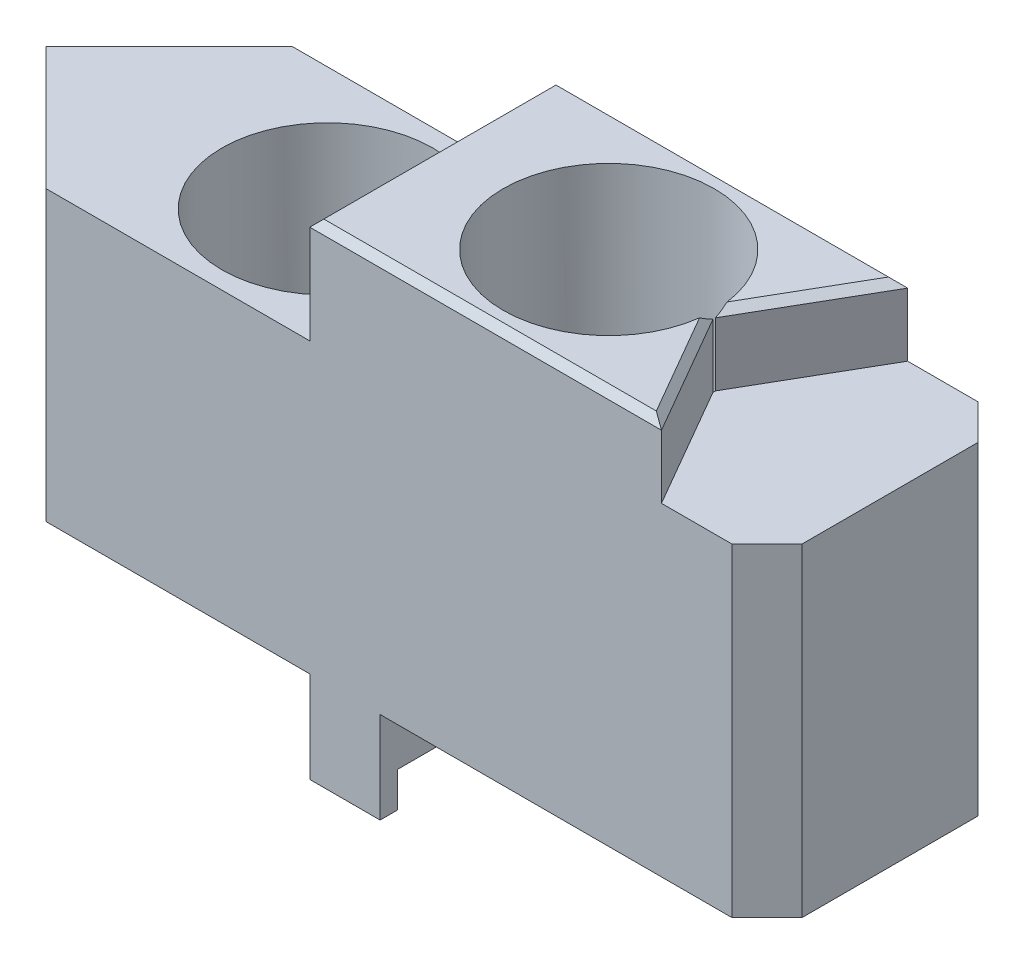
from build123d import *

# Parameters (mm, degrees)
SKETCH_1_W                = 24
SKETCH_1_H                = 13.8
EXTRUDE_1_DEPTH           = 3.5
HOLE_WIZARD_1_D           = 3.4
HOLE_WIZARD_1_CBORE_D     = 6
HOLE_WIZARD_1_CBORE_DEPTH = 9
CUT_EXTRUDE_1_DEPTH       = 2
SKETCH_5_W                = 11
SKETCH_5_H                = 2.6
SKETCH_5_H_2              = 3
CUT_EXTRUDE_2_DEPTH       = 16.511608556
SKETCH_6_W                = 2
SKETCH_6_H                = 6
CUT_EXTRUDE_3_DEPTH       = 1
CHAMFER_1_SIZE            = 3.5
CHAMFER_2_SIZE            = 0.2
CHAMFER_3_SIZE            = 1


with BuildPart() as part:
    # 草图1 → 凸台-拉伸1 (new, symmetric)
    with BuildSketch(Plane.XY):
        Rectangle(SKETCH_1_W, SKETCH_1_H)
    extrude(amount=EXTRUDE_1_DEPTH, both=True)

    # 打孔尺寸根据内六角圆柱头螺钉的类型1 (through all)
    with Locations(Plane(origin=(0, 6.9, 0), x_dir=(1, 0, 0), z_dir=(0, 1, 0))):
        with Locations((4, 0), (-4, 0)):
            CounterBoreHole(HOLE_WIZARD_1_D / 2, HOLE_WIZARD_1_CBORE_D / 2, HOLE_WIZARD_1_CBORE_DEPTH)

    # 草图4 → 切除-拉伸1 (cut)
    with BuildSketch(Plane(origin=(0, 6.9, 0), x_dir=(1, 0, 0), z_dir=(0, 1, 0))):
        Polygon((9, 3.5), (6.979274058, 0), (9, -3.5), (12, -3.5), (12, 3.5), align=None)
    extrude(amount=-CUT_EXTRUDE_1_DEPTH, mode=Mode.SUBTRACT)

    # 草图5 → 切除-拉伸2 (cut, through all)
    with BuildSketch(Plane.XY.offset(3.5)):
        with Locations((6.5, -5.6)):
            Rectangle(SKETCH_5_W, SKETCH_5_H)
        with Locations((-6.5, -5.6)):
            Rectangle(SKETCH_5_W, SKETCH_5_H)
        with Locations((-6.5, 5.4)):
            Rectangle(SKETCH_5_W, SKETCH_5_H_2)
    extrude(amount=-CUT_EXTRUDE_2_DEPTH, mode=Mode.SUBTRACT)

    # 草图6 → 切除-拉伸3 (cut)
    with BuildSketch(Plane.XZ.offset(6.9)):
        Rectangle(SKETCH_6_W, SKETCH_6_H)
    extrude(amount=-CUT_EXTRUDE_3_DEPTH, mode=Mode.SUBTRACT)

    # 倒角1
    chamfer_1_edges = [part.edges().sort_by_distance(p)[0] for p in [
        (-12, -0.2, -3.5),
        (-12, -0.2, 3.5),
    ]]
    chamfer(chamfer_1_edges, length=CHAMFER_1_SIZE - 0.0001)  # a hair under: the kernel refuses the full size

    # 倒角2
    chamfer_2_edges = [part.edges().sort_by_distance(p)[0] for p in [
        (4, 6.9, -3.5),
        (4, 6.9, 3.5),
        (7.999894775, 6.9, 1.767766937),
        (7.999894775, 6.9, -1.767766937),
        (-1, 6.9, 0),
    ]]
    chamfer(chamfer_2_edges, length=CHAMFER_2_SIZE)

    # 倒角3
    chamfer_3_edges = [part.edges().sort_by_distance(p)[0] for p in [
        (12, 0.3, -3.5),
        (12, 0.3, 3.5),
    ]]
    chamfer(chamfer_3_edges, length=CHAMFER_3_SIZE)


solid = part.part
